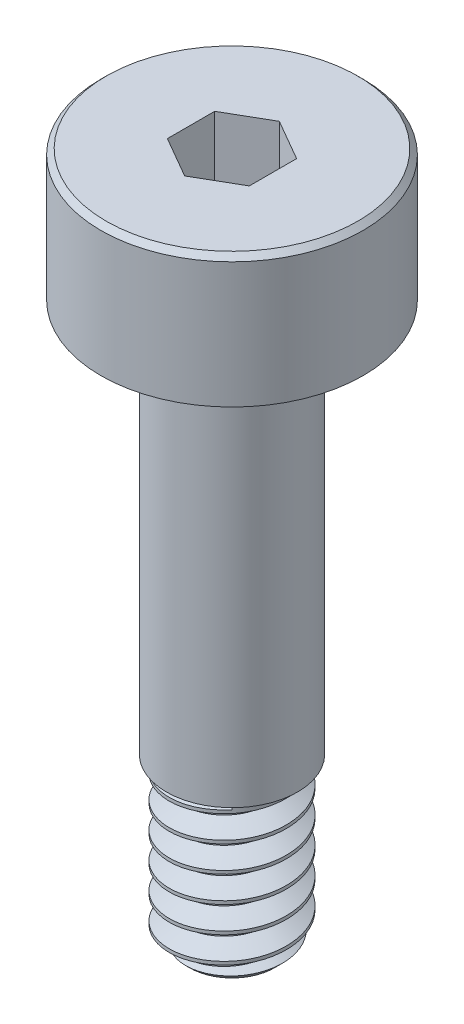
from build123d import *

# Parameters (mm, degrees)
SKETCH1_R          = 3.175
EXTRUDE1_DEPTH     = 3.175
CUT_EXTRUDE1_DEPTH = 1.5875
SKETCH4_R          = 1.5875
EXTRUDE2_DEPTH     = 9.525
SKETCH5_R          = 1.4224
EXTRUDE3_DEPTH     = 3.96875
CHAMFER1_SIZE      = 0.396875
CUT_SWEEP1_PITCH   = 0.635
CUT_SWEEP1_TO      = 3.96875


with BuildPart() as part:
    # Sketch1 → Extrude1 (new body)
    with BuildSketch(Plane(origin=(0, 0, 0), x_dir=(1, 0, 0), z_dir=(0, 1, 0))):
        with Locations(Location((0, 0, 0), (0, 0, 270))):
            Circle(SKETCH1_R)
    extrude(amount=EXTRUDE1_DEPTH)

    # Sketch2 → Cut-Extrude1 (cut)
    with BuildSketch(Plane(origin=(0, 3.175, 0), x_dir=(-1, 0, 0), z_dir=(0, 1, 0))):
        Polygon((0, -1.14567944), (0.9921875, -0.57283972), (0.9921875, 0.57283972), (0, 1.14567944), (-0.9921875, 0.57283972), (-0.9921875, -0.57283972), align=None)
    extrude(amount=-CUT_EXTRUDE1_DEPTH, mode=Mode.SUBTRACT)

    # Sketch4 → Extrude2 (add)
    with BuildSketch(Plane.XZ):
        with Locations(Location((0, 0, 0), (0, 0, 90))):
            Circle(SKETCH4_R)
    extrude(amount=EXTRUDE2_DEPTH)

    # Sketch5 → Extrude3 (add)
    with BuildSketch(Plane.XZ.offset(9.525)):
        with Locations(Location((0, 0, 0), (0, 0, 270))):
            Circle(SKETCH5_R)
    extrude(amount=EXTRUDE3_DEPTH)

    # Chamfer1
    chamfer1_edges = [part.edges().sort_by_distance(p)[0] for p in [
        (0, -13.49375, 1.4224),
    ]]
    chamfer(chamfer1_edges, length=CHAMFER1_SIZE)

    # Cut-Sweep1: arcs per turn and ends read off the stored shape
    # Cut-Sweep1: the profile of Sketch13 profile screwed along a right-hand helix through 7 turns, 6 arcs to a turn; built about Z, then put on its axis
    cut_sweep1_z = Axis((0, 0, 0), (0, 0, 1))
    cut_sweep1_corners = [(1.4227, 0, -0.079201795), (1.4227, 0, -0.635173205), (1.009955401, 0, -0.396875), (1.009955401, 0, -0.3175)]
    with BuildLine(mode=Mode.PRIVATE) as cut_sweep1_profile:
        Line(cut_sweep1_corners[0], cut_sweep1_corners[1])
        Line(cut_sweep1_corners[1], cut_sweep1_corners[2])
        Line(cut_sweep1_corners[2], cut_sweep1_corners[3])
        Line(cut_sweep1_corners[3], cut_sweep1_corners[0])
    cut_sweep1_cap = Face(cut_sweep1_profile.wire())
    cut_sweep1_turn_angles = [0, 30, 60, 90, 120, 150, 180, 210, 240, 270, 300, 330, 360]
    cut_sweep1_turn_weights = [1, 0.8660254037844387, 1, 0.8660254037844387, 1, 0.8660254037844387, 1, 0.8660254037844387, 1, 0.8660254037844387, 1, 0.8660254037844387, 1]
    cut_sweep1_turn_rails = [Edge.make_bspline([Vector(p[0], p[1], 0).rotate(cut_sweep1_z, cut_sweep1_turn_angles[k]) / cut_sweep1_turn_weights[k] + Vector(0, 0, p[2] + CUT_SWEEP1_PITCH * cut_sweep1_turn_angles[k] / 360) for k in range(13)], [0, 0, 0, 1, 1, 2, 2, 3, 3, 4, 4, 5, 5, 6, 6, 6], 2, cut_sweep1_turn_weights) for p in cut_sweep1_corners]
    cut_sweep1_turn_sides = [Face.make_surface_from_curves(cut_sweep1_turn_rails[p[0]], cut_sweep1_turn_rails[p[1]]) for p in [(0, 1), (1, 2), (2, 3), (3, 0)]]
    cut_sweep1 = Plane(origin=(0, -13.49375, 0), x_dir=(0.7071067811865438, 0, 0.7071067811865512), z_dir=(0, 1, 0)) * split(Solid(Shell([*[p.moved(Location((0, 0, CUT_SWEEP1_PITCH * i))) for i in range(7) for p in cut_sweep1_turn_sides], cut_sweep1_cap, cut_sweep1_cap.rotate(cut_sweep1_z, 2520).moved(Location((0, 0, CUT_SWEEP1_PITCH * 2520 / 360)))])), bisect_by=Plane.XY.offset(CUT_SWEEP1_TO), keep=Keep.BOTTOM, mode=Mode.PRIVATE)
    add(cut_sweep1, mode=Mode.SUBTRACT)

    # Sketch11 → Cut-Revolve7 (revolve, cut)
    with BuildSketch(Plane.XY, mode=Mode.PRIVATE) as cut_revolve7_sk:
        Polygon((3.175, 3.045510577), (3.045510577, 3.175), (3.175, 3.175), align=None)
    revolve(cut_revolve7_sk.sketch.rotate(Axis((0, 14.544175091, 0), (0, -1, 0)), 90), axis=Axis((0, 14.544175091, 0), (0, -1, 0)), mode=Mode.SUBTRACT)


solid = part.part
